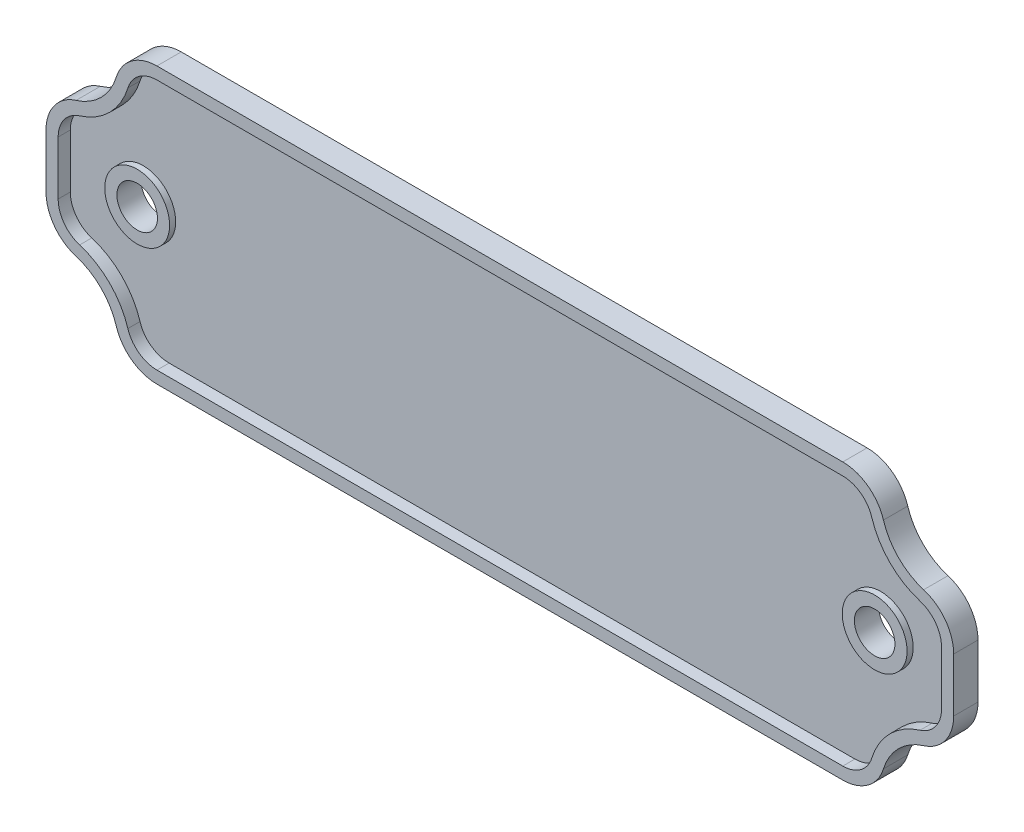
from build123d import *

# Parameters (mm, degrees)
SKETCH1_R                = 4
BOSS_EXTRUDE1_DEPTH      = 1.5
BOSS_EXTRUDE2_DEPTH      = 3
BOSS_EXTRUDE3_DEPTH      = 2.25
BOSS_EXTRUDE3_DEPTH_BACK = 0.75
SKETCH1_4_R              = 4
SKETCH1_4_R_2            = 2.5


with BuildPart() as part:
    # Sketch1 → Boss-Extrude1 (new body)
    with BuildSketch(Plane.XY):
        with BuildLine():
            ThreePointArc((45.898076983, 12.852941176), (44.541774365, 14.76649875), (42.313942393, 15.5))
            Line((42.313942393, 15.5), (-42.313942393, 15.5))
            ThreePointArc((-42.313942393, 15.5), (-44.541774365, 14.76649875), (-45.898076983, 12.852941176))
            ThreePointArc((-45.898076983, 12.852941176), (-48.136038969, 9.136038969), (-51.852941176, 6.898076983))
            ThreePointArc((-51.852941176, 6.898076983), (-53.76649875, 5.541774365), (-54.5, 3.313942393))
            Line((-54.5, 3.313942393), (-54.5, 0))
            Line((-54.5, 0), (-54.5, -3.313942393))
            ThreePointArc((-54.5, -3.313942393), (-53.76649875, -5.541774365), (-51.852941176, -6.898076983))
            ThreePointArc((-51.852941176, -6.898076983), (-48.136038969, -9.136038969), (-45.898076983, -12.852941176))
            ThreePointArc((-45.898076983, -12.852941176), (-44.541774365, -14.76649875), (-42.313942393, -15.5))
            Line((-42.313942393, -15.5), (42.313942393, -15.5))
            ThreePointArc((42.313942393, -15.5), (44.541774365, -14.76649875), (45.898076983, -12.852941176))
            ThreePointArc((45.898076983, -12.852941176), (48.136038969, -9.136038969), (51.852941176, -6.898076983))
            ThreePointArc((51.852941176, -6.898076983), (53.76649875, -5.541774365), (54.5, -3.313942393))
            Line((54.5, -3.313942393), (54.5, 0))
            Line((54.5, 0), (54.5, 3.313942393))
            ThreePointArc((54.5, 3.313942393), (53.76649875, 5.541774365), (51.852941176, 6.898076983))
            ThreePointArc((51.852941176, 6.898076983), (48.136038969, 9.136038969), (45.898076983, 12.852941176))
        make_face()
        with Locations((-45.5, 0)):
            Circle(SKETCH1_R, mode=Mode.SUBTRACT)
        with Locations((45.5, 0)):
            Circle(SKETCH1_R, mode=Mode.SUBTRACT)
    extrude(amount=BOSS_EXTRUDE1_DEPTH)

    # Sketch1<3> → Boss-Extrude2 (add)
    with BuildSketch(Plane.XY):
        with BuildLine():
            ThreePointArc((47.331730819, 13.294117647), (45.432907153, 15.973098249), (42.313942393, 17))
            Line((42.313942393, 17), (-42.313942393, 17))
            ThreePointArc((-42.313942393, 17), (-45.432907153, 15.973098249), (-47.331730819, 13.294117647))
            ThreePointArc((-47.331730819, 13.294117647), (-49.196699141, 10.196699141), (-52.294117647, 8.331730819))
            ThreePointArc((-52.294117647, 8.331730819), (-54.973098249, 6.432907153), (-56, 3.313942393))
            Line((-56, 3.313942393), (-56, 0))
            Line((-56, 0), (-56, -3.313942393))
            ThreePointArc((-56, -3.313942393), (-54.973098249, -6.432907153), (-52.294117647, -8.331730819))
            ThreePointArc((-52.294117647, -8.331730819), (-49.196699141, -10.196699141), (-47.331730819, -13.294117647))
            ThreePointArc((-47.331730819, -13.294117647), (-45.432907153, -15.973098249), (-42.313942393, -17))
            Line((-42.313942393, -17), (42.313942393, -17))
            ThreePointArc((42.313942393, -17), (45.432907153, -15.973098249), (47.331730819, -13.294117647))
            ThreePointArc((47.331730819, -13.294117647), (49.196699141, -10.196699141), (52.294117647, -8.331730819))
            ThreePointArc((52.294117647, -8.331730819), (54.973098249, -6.432907153), (56, -3.313942393))
            Line((56, -3.313942393), (56, 0))
            Line((56, 0), (56, 3.313942393))
            ThreePointArc((56, 3.313942393), (54.973098249, 6.432907153), (52.294117647, 8.331730819))
            ThreePointArc((52.294117647, 8.331730819), (49.196699141, 10.196699141), (47.331730819, 13.294117647))
        make_face()
        with BuildLine():
            Line((-42.313942393, 15.5), (42.313942393, 15.5))
            ThreePointArc((42.313942393, 15.5), (44.541774365, 14.76649875), (45.898076983, 12.852941176))
            ThreePointArc((45.898076983, 12.852941176), (48.136038969, 9.136038969), (51.852941176, 6.898076983))
            ThreePointArc((51.852941176, 6.898076983), (53.76649875, 5.541774365), (54.5, 3.313942393))
            Line((54.5, 3.313942393), (54.5, 0))
            Line((54.5, 0), (54.5, -3.313942393))
            ThreePointArc((54.5, -3.313942393), (53.76649875, -5.541774365), (51.852941176, -6.898076983))
            ThreePointArc((51.852941176, -6.898076983), (48.136038969, -9.136038969), (45.898076983, -12.852941176))
            ThreePointArc((45.898076983, -12.852941176), (44.541774365, -14.76649875), (42.313942393, -15.5))
            Line((42.313942393, -15.5), (-42.313942393, -15.5))
            ThreePointArc((-42.313942393, -15.5), (-44.541774365, -14.76649875), (-45.898076983, -12.852941176))
            ThreePointArc((-45.898076983, -12.852941176), (-48.136038969, -9.136038969), (-51.852941176, -6.898076983))
            ThreePointArc((-51.852941176, -6.898076983), (-53.76649875, -5.541774365), (-54.5, -3.313942393))
            Line((-54.5, -3.313942393), (-54.5, 0))
            Line((-54.5, 0), (-54.5, 3.313942393))
            ThreePointArc((-54.5, 3.313942393), (-53.76649875, 5.541774365), (-51.852941176, 6.898076983))
            ThreePointArc((-51.852941176, 6.898076983), (-48.136038969, 9.136038969), (-45.898076983, 12.852941176))
            ThreePointArc((-45.898076983, 12.852941176), (-44.541774365, 14.76649875), (-42.313942393, 15.5))
        make_face(mode=Mode.SUBTRACT)
    extrude(amount=BOSS_EXTRUDE2_DEPTH)

    # Sketch1<4> → Boss-Extrude3 (add, two sides: drawn at the far end of the back side and taken through both)
    # profile 1 of 2: a face of its own
    with BuildSketch(Plane.XY.offset(-BOSS_EXTRUDE3_DEPTH_BACK)):
        with Locations((-45.5, 0)):
            Circle(SKETCH1_4_R)
        with Locations((-45.5, 0)):
            Circle(SKETCH1_4_R_2, mode=Mode.SUBTRACT)
    # profile 2 of 2: a face of its own
    with BuildSketch(Plane.XY.offset(-BOSS_EXTRUDE3_DEPTH_BACK)):
        with Locations((45.5, 0)):
            Circle(SKETCH1_4_R)
        with Locations((45.5, 0)):
            Circle(SKETCH1_4_R_2, mode=Mode.SUBTRACT)
    extrude(amount=BOSS_EXTRUDE3_DEPTH + BOSS_EXTRUDE3_DEPTH_BACK)


solid = part.part
